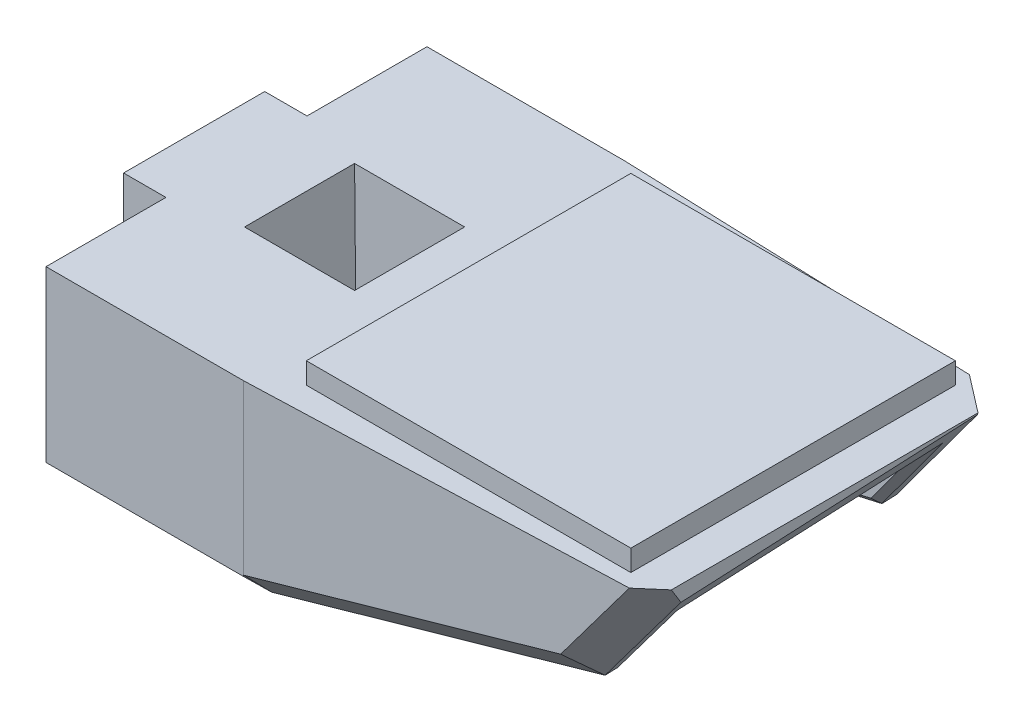
from build123d import *
from OCP.BRepFilletAPI import BRepFilletAPI_MakeChamfer

# Parameters (mm, degrees)
SKETCH2_W               = 28
SKETCH2_H               = 27
BOSS_EXTRUDE1_DEPTH     = 14
CUT_EXTRUDE1_DEPTH      = 24.963513933
CUT_EXTRUDE1_DEPTH_BACK = 24.963513933
CUT_EXTRUDE2_DEPTH      = 34.265162244
CUT_EXTRUDE2_DEPTH_BACK = 34.265162244
CUT_EXTRUDE5_DEPTH      = 5
CHAMFER9_SIZE           = 2
CHAMFER9_SIZE2          = 2.125118495
CHAMFER9_SIZE2_2        = 2.036669754
CHAMFER10_SIZE          = 0.5
CHAMFER10_SIZE_2        = 0.499756853
CHAMFER10_SIZE_3        = 0.355609596
CHAMFER10_SIZE_4        = 0.478182949
SKETCH8_W               = 23
SKETCH8_H               = 23
BOSS_EXTRUDE3_DEPTH     = 1.5
BOSS_EXTRUDE4_DEPTH     = 14
CHAMFER11_SIZE          = 1.981809494
CHAMFER11_SIZE_2        = 2
CHAMFER11_SIZE_3        = 2.018700778
SKETCH11_W              = 11
SKETCH11_H              = 10
BOSS_EXTRUDE5_DEPTH     = 2
CUT_EXTRUDE6_DEPTH      = 36.61773346
CUT_EXTRUDE6_DEPTH_BACK = 36.61773346
SKETCH12_W              = 7.8
SKETCH12_H              = 7.8
BOSS_EXTRUDE6_DEPTH     = 3
CHAMFER13_SIZE          = 0.2
CHAMFER14_SIZE          = 0.2


with BuildPart() as part:
    # Sketch2 → Boss-Extrude1 (new body)
    with BuildSketch(Plane(origin=(0, 0, 0), x_dir=(1, 0, 0), z_dir=(0, 1, 0))):
        Rectangle(SKETCH2_W, SKETCH2_H)
    extrude(amount=BOSS_EXTRUDE1_DEPTH)

    # Sketch3 → Cut-Extrude1 (cut, two sides: drawn at the far end of the back side and taken through both)
    with BuildSketch(Plane.XZ.offset(-CUT_EXTRUDE1_DEPTH_BACK)):
        Polygon((14, 12.5), (-14, 13.5), (14, 13.5), align=None)
        Polygon((-14, -13.5), (14, -12.5), (14, -13.5), align=None)
    extrude(amount=CUT_EXTRUDE1_DEPTH + CUT_EXTRUDE1_DEPTH_BACK, mode=Mode.SUBTRACT)

    # Sketch4 → Cut-Extrude2 (cut, two sides: drawn at the far end of the back side and taken through both)
    with BuildSketch(Plane(origin=(0.463694268, 0, 12.98343949), x_dir=(0.9993628543475497, 0, -0.03569153051241239), z_dir=(0.03569153051241239, 0, 0.9993628543475497)).offset(-CUT_EXTRUDE2_DEPTH_BACK)):
        Polygon((4.393476436, 0), (13.544935829, 0), (14.437224092, 0), (14.437224092, 3.200858801), (14.437224092, 14), (8.423118558, 5.915663704), (-14.472915623, 0), align=None)
    extrude(amount=CUT_EXTRUDE2_DEPTH + CUT_EXTRUDE2_DEPTH_BACK, mode=Mode.SUBTRACT)

    # Sketch7 → Cut-Extrude5 (cut)
    with BuildSketch(Plane(origin=(-0.90510884, 3.505374242, 0.032325316), x_dir=(0.9682467311609488, 0.2499859061521866, 0.002305281199245587), z_dir=(0.24999653516826476, -0.9682055645501146, -0.00892844768458086))):
        Polygon((-11.52433294, 10), (-11.52433294, -10), (15.026440907, -9), (15.026440907, 9), align=None)
    extrude(amount=-CUT_EXTRUDE5_DEPTH, mode=Mode.SUBTRACT)

    # Chamfer9: one chamfer whose edges measure the first distance from different faces: ONE call of the kernel's chamfer builder (chamfer() names one face for all edges)
    chamfer9_edges_1 = [part.edges().sort_by_distance(p)[0] for p in [
        (10.987187207, 9.957831852, -12.607600457),
    ]]
    chamfer9_side_1 = [part.faces().sort_by_distance(p)[0] for p in [
        (8.200833453, 6.134911733, -10.944147911),
    ]]
    chamfer9_edges_2 = [part.edges().sort_by_distance(p)[0] for p in [
        (-3.012812793, 3.082324055, -13.107600457),
    ]]
    chamfer9_side_2 = [part.faces().sort_by_distance(p)[0] for p in [
        (8.472861151, 5.825901441, 10.976294715),
    ]]
    chamfer9_edges_3 = [part.edges().sort_by_distance(p)[0] for p in [
        (11.440723036, 9.358111881, 12.591402749),
        (-2.559276964, 2.957831852, 13.091402749),
    ]]
    chamfer9 = BRepFilletAPI_MakeChamfer(part.part.solid().wrapped)
    for e in chamfer9_edges_1:
        chamfer9.Add(CHAMFER9_SIZE, CHAMFER9_SIZE2, e.wrapped, chamfer9_side_1[0].wrapped)  # the first distance lies on this face
    for e in chamfer9_edges_2:
        chamfer9.Add(CHAMFER9_SIZE, CHAMFER9_SIZE2_2, e.wrapped, chamfer9_side_2[0].wrapped)  # the first distance lies on this face
    for e in chamfer9_edges_3:
        chamfer9.Add(CHAMFER9_SIZE, e.wrapped)
    add(Compound.cast(chamfer9.Shape()), mode=Mode.REPLACE)

    # Chamfer10
    # the kernel refuses this chamfer: 0.5, 0.499756853, 0.478182949, 0.355609596 mm, written as the material it takes off along each edge
    with BuildSketch(Plane(origin=(13.393805694, 12.150550502, 9.074748342), x_dir=(0.05808492213468299, -0.0159272826215481, 0.9981845838766), z_dir=(-0.5964718159494269, -0.8023350086458182, 0.021906772453014096))) as chamfer10_piece_1_section:
        Polygon((CHAMFER10_SIZE * 0.999621916911, CHAMFER10_SIZE * 0.0274958766106), (-CHAMFER10_SIZE_2 * 0.0270094090309, CHAMFER10_SIZE_2 * 0.99963518004), (0, 0), align=None)
    chamfer10_piece_1 = extrude(amount=9.056768515, mode=Mode.PRIVATE)
    chamfer10_piece_1 = split(chamfer10_piece_1, bisect_by=Plane(origin=(13.194045261, 8.919569719, 9.362412532), z_dir=(-0.9682467311609487, -0.2499859061521866, -0.002305281199245587)), keep=Keep.TOP, mode=Mode.PRIVATE)
    add(chamfer10_piece_1, mode=Mode.SUBTRACT)
    with BuildSketch(Plane(origin=(12.483603901, 11.851435136, -10.17642201), x_dir=(0.6410905937629469, 0.7670777517517646, 0.02438387492033602), z_dir=(0.007423820423546566, -0.03796872134677927, 0.9992513513073723))) as chamfer10_piece_2_section:
        Polygon((CHAMFER10_SIZE_3 * 0.998458969631, CHAMFER10_SIZE_3 * 0.0554949312847), (CHAMFER10_SIZE * 0.582893294976, CHAMFER10_SIZE * 0.812548710338), (0, 0), align=None)
    chamfer10_piece_2 = extrude(amount=20.579624749, mode=Mode.PRIVATE)
    chamfer10_piece_2 = split(chamfer10_piece_2, bisect_by=Plane(origin=(12.913774256, 11.712919177, 9.092338186), z_dir=(-0.03644190228685181, -0.00019400043812537604, -0.9993357544496974)), keep=Keep.TOP, mode=Mode.PRIVATE)
    chamfer10_piece_2 = split(chamfer10_piece_2, bisect_by=Plane(origin=(12.918206265, 11.879748292, -8.874602582), z_dir=(-0.036441902286851825, -0.01862343869573062, 0.9991622267123904)), keep=Keep.TOP, mode=Mode.PRIVATE)
    chamfer10_piece_2 = split(chamfer10_piece_2, bisect_by=Plane(origin=(12.481573161, 12.124794955, 0.172665498), z_dir=(0.24999653516826476, -0.9682055645501146, -0.008928447684580858)), keep=Keep.TOP, mode=Mode.PRIVATE)
    add(chamfer10_piece_2, mode=Mode.SUBTRACT)
    with BuildSketch(Plane(origin=(7.332927257, 4.885726315, -9.208673389), x_dir=(0.02308828920705216, 0.028593105881686263, -0.9993244544178482), z_dir=(0.5975594668303494, 0.8009831640871496, 0.03672403096566061))) as chamfer10_piece_3_section:
        Polygon((CHAMFER10_SIZE_4 * 0.99954799042, CHAMFER10_SIZE_4 * 0.0300634926507), (CHAMFER10_SIZE * 0.0166649416169, CHAMFER10_SIZE * 0.999861130218), (0, 0), align=None)
    chamfer10_piece_3 = extrude(amount=9.921337686, mode=Mode.PRIVATE)
    chamfer10_piece_3 = split(chamfer10_piece_3, bisect_by=Plane(origin=(13.127154568, 9.349828107, -9.200111372), z_dir=(-0.9682467311609487, -0.2499859061521866, -0.002305281199245587)), keep=Keep.TOP, mode=Mode.PRIVATE)
    chamfer10_piece_3 = split(chamfer10_piece_3, bisect_by=Plane(origin=(9.07925667, 11.33256006, -9.181827322), z_dir=(0.24999653516826476, -0.9682055645501146, -0.008928447684580858)), keep=Keep.TOP, mode=Mode.PRIVATE)
    add(chamfer10_piece_3, mode=Mode.SUBTRACT)
    with BuildSketch(Plane(origin=(10.002796446, 6.23732447, 9.199553239), x_dir=(0.04330199810393728, -0.02642773364671087, 0.9987124270051441), z_dir=(-0.9675607061893213, -0.25015584570028293, 0.035331752014273944))) as chamfer10_piece_4_section:
        Polygon((CHAMFER10_SIZE * 0.999621916911, CHAMFER10_SIZE * 0.0274958766106), (-CHAMFER10_SIZE * 0.0274958766106, CHAMFER10_SIZE * 0.999621916911), (0, 0), align=None)
    chamfer10_piece_4 = extrude(amount=24.091958818, mode=Mode.PRIVATE)
    chamfer10_piece_4 = split(chamfer10_piece_4, bisect_by=Plane(origin=(-12.104726667, 0.6943181, 9.74256285), z_dir=(0.9682467311609487, 0.2499859061521866, 0.002305281199245587)), keep=Keep.TOP, mode=Mode.PRIVATE)
    add(chamfer10_piece_4, mode=Mode.SUBTRACT)
    with BuildSketch(Plane(origin=(-12.063506538, 0.520383834, 11.291120145), x_dir=(-0.9610067795621441, -0.27651305144520855, -0.00254990510726875), z_dir=(0, 0.009221252597336898, -0.9999574833464352))) as chamfer10_piece_5_section:
        Polygon((CHAMFER10_SIZE * 0.999621916911, CHAMFER10_SIZE * 0.0274958766106), (-CHAMFER10_SIZE * 0.0274958766106, CHAMFER10_SIZE * 0.999621916911), (0, 0), align=None)
    chamfer10_piece_5 = extrude(amount=22.571682988, mode=Mode.PRIVATE)
    chamfer10_piece_5 = split(chamfer10_piece_5, bisect_by=Plane(origin=(-11.900053771, 0.744779528, 9.999331572), z_dir=(-0.03644190228685181, -0.00019400043812537604, -0.9993357544496974)), keep=Keep.TOP, mode=Mode.PRIVATE)
    chamfer10_piece_5 = split(chamfer10_piece_5, bisect_by=Plane(origin=(-11.900053771, 0.929057753, -9.983896039), z_dir=(-0.036441902286851825, -0.01862343869573062, 0.9991622267123904)), keep=Keep.TOP, mode=Mode.PRIVATE)
    add(chamfer10_piece_5, mode=Mode.SUBTRACT)
    with BuildSketch(Plane(origin=(-13.307636242, 0.395897718, -10.045171631), x_dir=(0.0433019981039377, -0.008005263248046781, -0.9990299558674586), z_dir=(0.9675607061893213, 0.24946172513101106, 0.03993904772377272))) as chamfer10_piece_6_section:
        Polygon((CHAMFER10_SIZE * 0.999621916911, CHAMFER10_SIZE * 0.0274958766106), (-CHAMFER10_SIZE * 0.0274958766106, CHAMFER10_SIZE * 0.999621916911), (0, 0), align=None)
    chamfer10_piece_6 = extrude(amount=23.412546433, mode=Mode.PRIVATE)
    chamfer10_piece_6 = split(chamfer10_piece_6, bisect_by=Plane(origin=(-12.104726559, 0.873987139, -9.740887367), z_dir=(0.9682467311609487, 0.2499859061521866, 0.002305281199245587)), keep=Keep.TOP, mode=Mode.PRIVATE)
    add(chamfer10_piece_6, mode=Mode.SUBTRACT)
    with BuildSketch(Plane(origin=(12.483603901, 11.851435136, -10.17642201), x_dir=(0.6410905937629469, 0.7670777517517646, 0.02438387492033602), z_dir=(0.007423820423546566, -0.03796872134677927, 0.9992513513073723))) as chamfer10_piece_7a_section:
        Polygon((CHAMFER10_SIZE_3 * 0.998458969631, CHAMFER10_SIZE_3 * 0.0554949312847), (CHAMFER10_SIZE * 0.582893294976, CHAMFER10_SIZE * 0.812548710338), (0, 0), align=None)
    chamfer10_piece_7a = extrude(amount=20.579624749, mode=Mode.PRIVATE)
    chamfer10_piece_7a = split(chamfer10_piece_7a, bisect_by=Plane(origin=(12.635030827, 11.348772137, 9.10257357), z_dir=(0.03644190228685181, 0.00019400043812537604, 0.9993357544496974)), keep=Keep.TOP, mode=Mode.PRIVATE)
    with BuildSketch(Plane(origin=(13.393805694, 12.150550502, 9.074748342), x_dir=(0.05808492213468299, -0.0159272826215481, 0.9981845838766), z_dir=(-0.5964718159494269, -0.8023350086458182, 0.021906772453014096))) as chamfer10_piece_7b_section:
        Polygon((CHAMFER10_SIZE * 0.999621916911, CHAMFER10_SIZE * 0.0274958766106), (-CHAMFER10_SIZE_2 * 0.0270094090309, CHAMFER10_SIZE_2 * 0.99963518004), (0, 0), align=None)
    chamfer10_piece_7b = extrude(amount=9.056768515, mode=Mode.PRIVATE)
    chamfer10_piece_7b = split(chamfer10_piece_7b, bisect_by=Plane(origin=(12.487037388, 11.658879354, 9.262321046), z_dir=(0.9682467311609487, 0.2499859061521866, 0.002305281199245587)), keep=Keep.TOP, mode=Mode.PRIVATE)
    chamfer10_piece_7 = chamfer10_piece_7a & chamfer10_piece_7b
    add(chamfer10_piece_7, mode=Mode.SUBTRACT)
    with BuildSketch(Plane(origin=(7.332927257, 4.885726315, -9.208673389), x_dir=(0.02308828920705216, 0.028593105881686263, -0.9993244544178482), z_dir=(0.5975594668303494, 0.8009831640871496, 0.03672403096566061))) as chamfer10_piece_8a_section:
        Polygon((CHAMFER10_SIZE_4 * 0.99954799042, CHAMFER10_SIZE_4 * 0.0300634926507), (CHAMFER10_SIZE * 0.0166649416169, CHAMFER10_SIZE * 0.999861130218), (0, 0), align=None)
    chamfer10_piece_8a = extrude(amount=9.921337686, mode=Mode.PRIVATE)
    chamfer10_piece_8a = split(chamfer10_piece_8a, bisect_by=Plane(origin=(12.430073193, 12.048679653, -9.082159345), z_dir=(0.9682467311609487, 0.2499859061521866, 0.002305281199245587)), keep=Keep.TOP, mode=Mode.PRIVATE)
    chamfer10_piece_8a = split(chamfer10_piece_8a, bisect_by=Plane(origin=(12.566907766, 12.23215797, -9.080467373), z_dir=(0.24999653516826476, -0.9682055645501146, -0.008928447684580858)), keep=Keep.TOP, mode=Mode.PRIVATE)
    with BuildSketch(Plane(origin=(12.483603901, 11.851435136, -10.17642201), x_dir=(0.6410905937629469, 0.7670777517517646, 0.02438387492033602), z_dir=(0.007423820423546566, -0.03796872134677927, 0.9992513513073723))) as chamfer10_piece_8b_section:
        Polygon((CHAMFER10_SIZE_3 * 0.998458969631, CHAMFER10_SIZE_3 * 0.0554949312847), (CHAMFER10_SIZE * 0.582893294976, CHAMFER10_SIZE * 0.812548710338), (0, 0), align=None)
    chamfer10_piece_8b = extrude(amount=20.579624749, mode=Mode.PRIVATE)
    chamfer10_piece_8b = split(chamfer10_piece_8b, bisect_by=Plane(origin=(12.507794791, 12.045003198, -8.886491102), z_dir=(0.036441902286851825, 0.01862343869573062, -0.9991622267123904)), keep=Keep.TOP, mode=Mode.PRIVATE)
    chamfer10_piece_8b = split(chamfer10_piece_8b, bisect_by=Plane(origin=(12.489689166, 12.216249647, -9.517481187), z_dir=(0.24999653516826476, -0.9682055645501146, -0.008928447684580858)), keep=Keep.TOP, mode=Mode.PRIVATE)
    chamfer10_piece_8 = chamfer10_piece_8a & chamfer10_piece_8b
    add(chamfer10_piece_8, mode=Mode.SUBTRACT)
    with BuildSketch(Plane(origin=(10.002796446, 6.23732447, 9.199553239), x_dir=(0.04330199810393728, -0.02642773364671087, 0.9987124270051441), z_dir=(-0.9675607061893213, -0.25015584570028293, 0.035331752014273944))) as chamfer10_piece_9a_section:
        Polygon((CHAMFER10_SIZE * 0.999621916911, CHAMFER10_SIZE * 0.0274958766106), (-CHAMFER10_SIZE * 0.0274958766106, CHAMFER10_SIZE * 0.999621916911), (0, 0), align=None)
    chamfer10_piece_9a = extrude(amount=24.091958818, mode=Mode.PRIVATE)
    chamfer10_piece_9a = split(chamfer10_piece_9a, bisect_by=Plane(origin=(-12.10479262, 0.6903974, 10.195426996), z_dir=(-0.9682467311609487, -0.2499859061521866, -0.002305281199245587)), keep=Keep.TOP, mode=Mode.PRIVATE)
    with BuildSketch(Plane(origin=(-12.063506538, 0.520383834, 11.291120145), x_dir=(-0.9610067795621441, -0.27651305144520855, -0.00254990510726875), z_dir=(0, 0.009221252597336898, -0.9999574833464352))) as chamfer10_piece_9b_section:
        Polygon((CHAMFER10_SIZE * 0.999621916911, CHAMFER10_SIZE * 0.0274958766106), (-CHAMFER10_SIZE * 0.0274958766106, CHAMFER10_SIZE * 0.999621916911), (0, 0), align=None)
    chamfer10_piece_9b = extrude(amount=22.571682988, mode=Mode.PRIVATE)
    chamfer10_piece_9b = split(chamfer10_piece_9b, bisect_by=Plane(origin=(-12.287300879, 0.644950584, 10.013472353), z_dir=(0.03644190228685181, 0.00019400043812537604, 0.9993357544496974)), keep=Keep.TOP, mode=Mode.PRIVATE)
    chamfer10_piece_9 = chamfer10_piece_9a & chamfer10_piece_9b
    add(chamfer10_piece_9, mode=Mode.SUBTRACT)
    with BuildSketch(Plane(origin=(-12.063506538, 0.520383834, 11.291120145), x_dir=(-0.9610067795621441, -0.27651305144520855, -0.00254990510726875), z_dir=(0, 0.009221252597336898, -0.9999574833464352))) as chamfer10_piece_10a_section:
        Polygon((CHAMFER10_SIZE * 0.999621916911, CHAMFER10_SIZE * 0.0274958766106), (-CHAMFER10_SIZE * 0.0274958766106, CHAMFER10_SIZE * 0.999621916911), (0, 0), align=None)
    chamfer10_piece_10a = extrude(amount=22.571682988, mode=Mode.PRIVATE)
    chamfer10_piece_10a = split(chamfer10_piece_10a, bisect_by=Plane(origin=(-12.287300879, 0.829506566, -9.999875433), z_dir=(0.036441902286851825, 0.01862343869573062, -0.9991622267123904)), keep=Keep.TOP, mode=Mode.PRIVATE)
    with BuildSketch(Plane(origin=(-13.307636242, 0.395897718, -10.045171631), x_dir=(0.0433019981039377, -0.008005263248046781, -0.9990299558674586), z_dir=(0.9675607061893213, 0.24946172513101106, 0.03993904772377272))) as chamfer10_piece_10b_section:
        Polygon((CHAMFER10_SIZE * 0.999621916911, CHAMFER10_SIZE * 0.0274958766106), (-CHAMFER10_SIZE * 0.0274958766106, CHAMFER10_SIZE * 0.999621916911), (0, 0), align=None)
    chamfer10_piece_10b = extrude(amount=23.412546433, mode=Mode.PRIVATE)
    chamfer10_piece_10b = split(chamfer10_piece_10b, bisect_by=Plane(origin=(-12.10479262, 0.87830121, -10.180961015), z_dir=(-0.9682467311609487, -0.2499859061521866, -0.002305281199245587)), keep=Keep.TOP, mode=Mode.PRIVATE)
    chamfer10_piece_10 = chamfer10_piece_10a & chamfer10_piece_10b
    add(chamfer10_piece_10, mode=Mode.SUBTRACT)

    # Sketch9 → Boss-Extrude4 (add)
    with BuildSketch(Plane.ZY.offset(14)):
        Polygon((13.5, 14), (13.5, 0), (-13.5, 0.248984406), (-13.5, 14), align=None)
    extrude(amount=BOSS_EXTRUDE4_DEPTH)

    # Chamfer11
    # the kernel refuses this chamfer: 2.018700778, 2, 1.981809494 mm, written as the material it takes off along each edge
    with BuildSketch(Plane(origin=(-8.856634024, 0, 13.5), x_dir=(0, 0.999607847931299, 0.028002684766947932), z_dir=(-1, 0, 0))) as chamfer11_piece_1:
        Polygon((CHAMFER11_SIZE * 0.999607847913, CHAMFER11_SIZE * 0.0280026847664), (-CHAMFER11_SIZE_2 * 0.0187838577224, CHAMFER11_SIZE_2 * 0.99982356778), (0, 0), align=None)
    extrude(amount=24.286731952, mode=Mode.SUBTRACT)
    with BuildSketch(Plane(origin=(-8.807268021, 0.248984406, -13.5), x_dir=(0, 0.9996150154540677, -0.027745646122666685), z_dir=(-1, 0, 0))) as chamfer11_piece_2:
        Polygon((CHAMFER11_SIZE_2 * 0.999615015454, -CHAMFER11_SIZE_2 * 0.0277456461227), (-CHAMFER11_SIZE_3 * 0.0369621690318, -CHAMFER11_SIZE_3 * 0.999316665654), (0, 0), align=None)
    extrude(amount=24.385463958, mode=Mode.SUBTRACT)

    # Sketch11 → Boss-Extrude5 (add)
    with BuildSketch(Plane(origin=(0, 0.124481617, 0.001147925), x_dir=(1, 0, 0), z_dir=(0, -0.9999574833464353, -0.00922125259733687))):
        with Locations((-19.5, 0)):
            Rectangle(SKETCH11_W, SKETCH11_H)
    extrude(amount=BOSS_EXTRUDE5_DEPTH)

    # Sketch12 → Cut-Extrude6 (cut, two sides: drawn at the far end of the back side and taken through both)
    with BuildSketch(Plane(origin=(0, -1.875433349, -0.01729458), x_dir=(1, 0, 0), z_dir=(0, -0.9999574833464353, -0.009221252597336872)).offset(-CUT_EXTRUDE6_DEPTH_BACK)):
        with Locations((-19.5, 0)):
            Rectangle(SKETCH12_W, SKETCH12_H)
    extrude(amount=CUT_EXTRUDE6_DEPTH + CUT_EXTRUDE6_DEPTH_BACK, mode=Mode.SUBTRACT)

    # Sketch13 → Boss-Extrude6 (add)
    with BuildSketch(Plane.ZY.offset(28)):
        Polygon((4.999787417, 0.07838594), (4.999787417, 14), (-4.999787417, 14), (-4.999787417, 0.170598466), align=None)
    extrude(amount=BOSS_EXTRUDE6_DEPTH)

    # Chamfer13
    chamfer13_edges = [part.edges().sort_by_distance(p)[0] for p in [
        (-14, -1.875433349, -0.01729458),
        (-19.5, -1.921539612, 4.982492837),
        (-25, -1.875433349, -0.01729458),
        (-19.5, -1.829327086, -5.017081997),
    ]]
    chamfer(chamfer13_edges, length=CHAMFER13_SIZE)

    # Chamfer14
    chamfer14_edges = [part.edges().sort_by_distance(p)[0] for p in [
        (-25, -0.821586381, 4.992636215),
        (-14, -0.821586381, 4.992636215),
        (-25, -0.729373855, -5.006938619),
        (-14, -0.729373855, -5.006938619),
    ]]
    chamfer(chamfer14_edges, length=CHAMFER14_SIZE)


with BuildPart() as body_2:
    # Sketch8 → Boss-Extrude3 (new body)
    with BuildSketch(Plane(origin=(0, 14, 0), x_dir=(1, 0, 0), z_dir=(0, 1, 0))):
        with Locations((0, -0.05)):
            Rectangle(SKETCH8_W, SKETCH8_H)
    extrude(amount=BOSS_EXTRUDE3_DEPTH)


solid = Compound([part.part, body_2.part])
